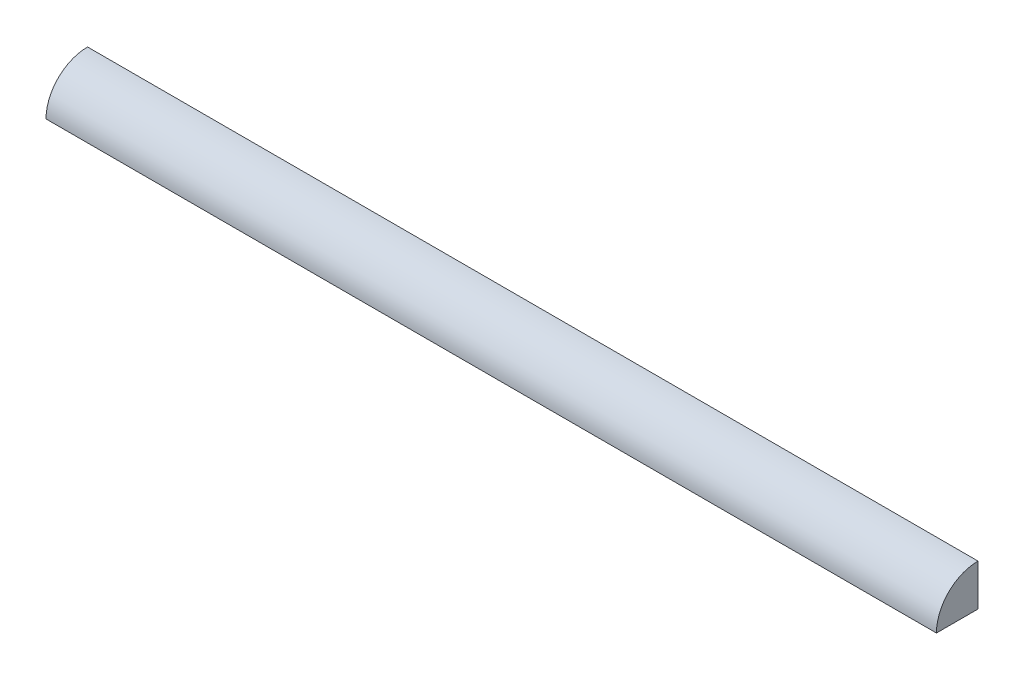
from build123d import *

# Parameters (mm, degrees)
ESQUISSE1_W        = 600
ESQUISSE1_H        = 28
BOSS_EXTRU_1_DEPTH = 28
CONG_1_R           = 28


with BuildPart() as part:
    # Esquisse1 → Boss.-Extru.1 (new body)
    with BuildSketch(Plane.XY):
        with Locations((188.823529412, 32.735294118)):
            Rectangle(ESQUISSE1_W, ESQUISSE1_H)
    extrude(amount=BOSS_EXTRU_1_DEPTH)

    # Congé1
    cong_1_edges = [part.edges().sort_by_distance(p)[0] for p in [
        (188.823529412, 46.735294118, 28),
    ]]
    fillet(cong_1_edges, radius=CONG_1_R - 0.0001)  # a hair under: the kernel refuses the full size


solid = part.part
